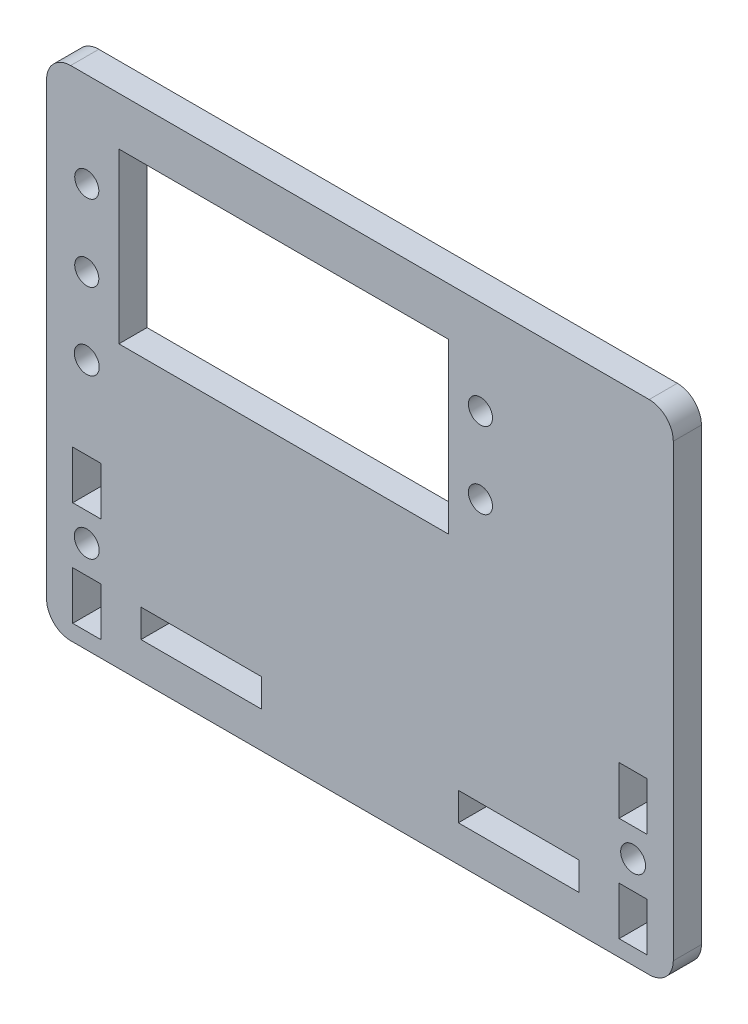
from build123d import *

# Parameters (mm, degrees)
SKETCH1_W               = 41
SKETCH1_H               = 21
BOSS_EXTRUDE1_DEPTH     = 3.5
SKETCH2_R               = 1.55
SKETCH2_W               = 3.5
SKETCH2_H               = 6
CUT_EXTRUDE1_DEPTH      = 50.942466899
SKETCH3_W               = 15
SKETCH3_H               = 3.5
CUT_EXTRUDE2_DEPTH      = 50.942466899
CUT_EXTRUDE3_DEPTH      = 50.942466899
CUT_EXTRUDE3_DEPTH_BACK = 50.942466899
SKETCH4_R               = 1.5
CUT_EXTRUDE4_REACH      = 51.942
SKETCH5_R               = 1.55


with BuildPart() as part:
    # Sketch1 → Boss-Extrude1 (new body)
    with BuildSketch(Plane.XY):
        with BuildLine():
            Line((-36, -31), (36, -31))
            ThreePointArc((36, -31), (38.121320344, -30.121320344), (39, -28))
            Line((39, -28), (39, 28))
            ThreePointArc((39, 28), (38.121320344, 30.121320344), (36, 31))
            Line((36, 31), (-36, 31))
            ThreePointArc((-36, 31), (-38.121320344, 30.121320344), (-39, 28))
            Line((-39, 28), (-39, -28))
            ThreePointArc((-39, -28), (-38.121320344, -30.121320344), (-36, -31))
        make_face()
        with Locations((-9.5, 14.5)):
            Rectangle(SKETCH1_W, SKETCH1_H, mode=Mode.SUBTRACT)
    extrude(amount=BOSS_EXTRUDE1_DEPTH)

    # Sketch2 → Cut-Extrude1 (cut, through all)
    with BuildSketch(Plane.XY.offset(3.5)):
        with Locations((34, -19.5)):
            Circle(SKETCH2_R)
        with Locations((-34, -19.5)):
            Circle(SKETCH2_R)
        with Locations((34, -13)):
            Rectangle(SKETCH2_W, SKETCH2_H)
        with Locations((34, -26)):
            Rectangle(SKETCH2_W, SKETCH2_H)
        with Locations((-34, -26)):
            Rectangle(SKETCH2_W, SKETCH2_H)
        with Locations((-34, -13)):
            Rectangle(SKETCH2_W, SKETCH2_H)
    extrude(amount=-CUT_EXTRUDE1_DEPTH, mode=Mode.SUBTRACT)

    # Sketch3 → Cut-Extrude2 (cut, through all)
    with BuildSketch(Plane.XY.offset(3.5)):
        with Locations((-19.75, -24.75)):
            Rectangle(SKETCH3_W, SKETCH3_H)
        with Locations((19.75, -24.75)):
            Rectangle(SKETCH3_W, SKETCH3_H)
    extrude(amount=-CUT_EXTRUDE2_DEPTH, mode=Mode.SUBTRACT)

    # Sketch4 → Cut-Extrude3 (cut, two sides: drawn at the far end of the back side and taken through both)
    with BuildSketch(Plane.XY.offset(3.5).offset(-CUT_EXTRUDE3_DEPTH_BACK)):
        with Locations((15, 19.25)):
            Circle(SKETCH4_R)
        with Locations((15, 9.75)):
            Circle(SKETCH4_R)
        with Locations((-34, 9.75)):
            Circle(SKETCH4_R)
        with Locations((-34, 19.25)):
            Circle(SKETCH4_R)
    extrude(amount=CUT_EXTRUDE3_DEPTH + CUT_EXTRUDE3_DEPTH_BACK, mode=Mode.SUBTRACT)

    # Sketch5 → Cut-Extrude4 (cut, up to next)
    with BuildSketch(Plane.XY.offset(3.5), mode=Mode.PRIVATE) as cut_extrude4_sk1:
        with Locations((-34, 0.25)):
            Circle(SKETCH5_R)
    cut_extrude4_tool1 = extrude(cut_extrude4_sk1.sketch, amount=-CUT_EXTRUDE4_REACH, mode=Mode.PRIVATE) & part.part
    add(cut_extrude4_tool1.solids().sort_by_distance((-34, 0.25, 3.5))[0], mode=Mode.SUBTRACT)


solid = part.part
